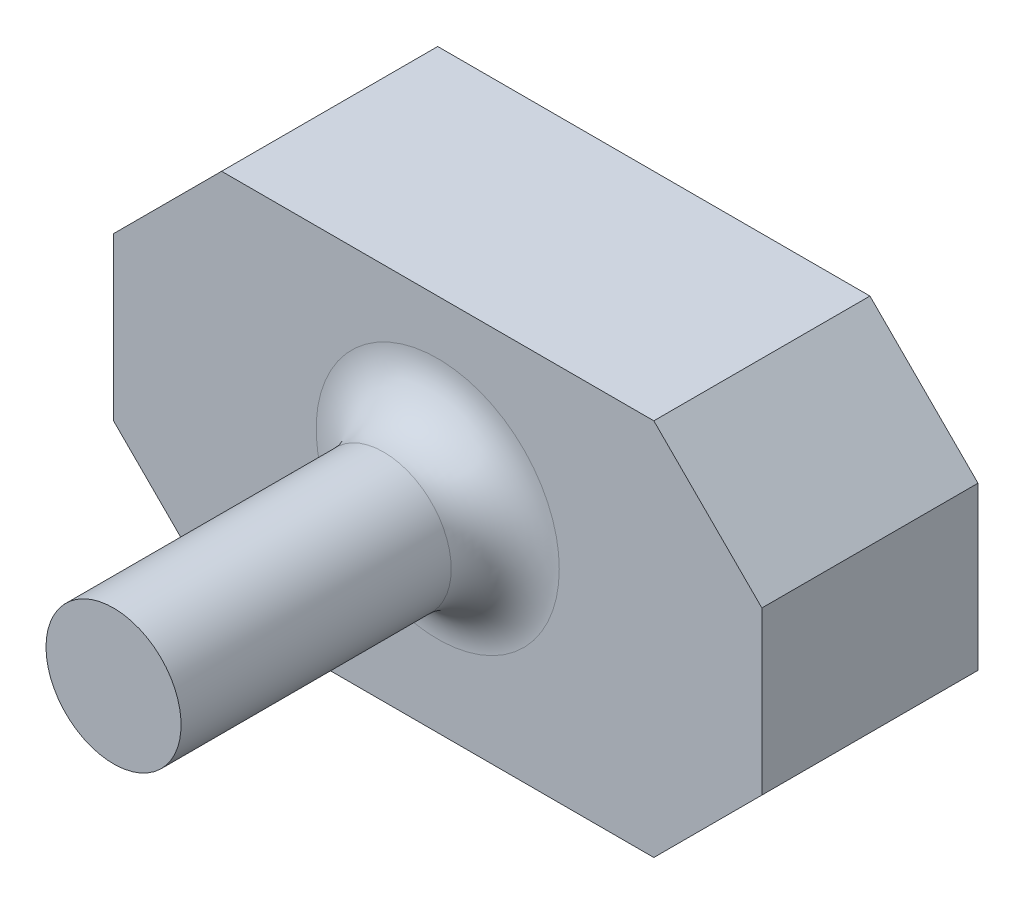
from build123d import *

# Parameters (mm, degrees)
SKETCH1_R           = 31.75
BOSS_EXTRUDE1_DEPTH = 152.4
BOSS_EXTRUDE2_DEPTH = 101.6
FILLET1_R           = 25.4


with BuildPart() as part:
    # Sketch1 → Boss-Extrude1 (new body)
    with BuildSketch(Plane.XY):
        with Locations((0, 95.25)):
            Circle(SKETCH1_R)
    extrude(amount=BOSS_EXTRUDE1_DEPTH)

    # Sketch2 → Boss-Extrude2 (add)
    with BuildSketch(Plane(origin=(0, 0, 0), x_dir=(-1, 0, 0), z_dir=(0, 0, -1))):
        Polygon((-101.6, 177.8), (-152.4, 127), (-152.4, 50.8), (-101.6, 0), (101.6, 0), (152.4, 50.8), (152.4, 127), (101.6, 177.8), align=None)
    extrude(amount=BOSS_EXTRUDE2_DEPTH)

    # Fillet1
    fillet1_edges = [part.edges().sort_by_distance(p)[0] for p in [
        (-31.75, 95.25, 0),
    ]]
    fillet(fillet1_edges, radius=FILLET1_R)


solid = part.part
